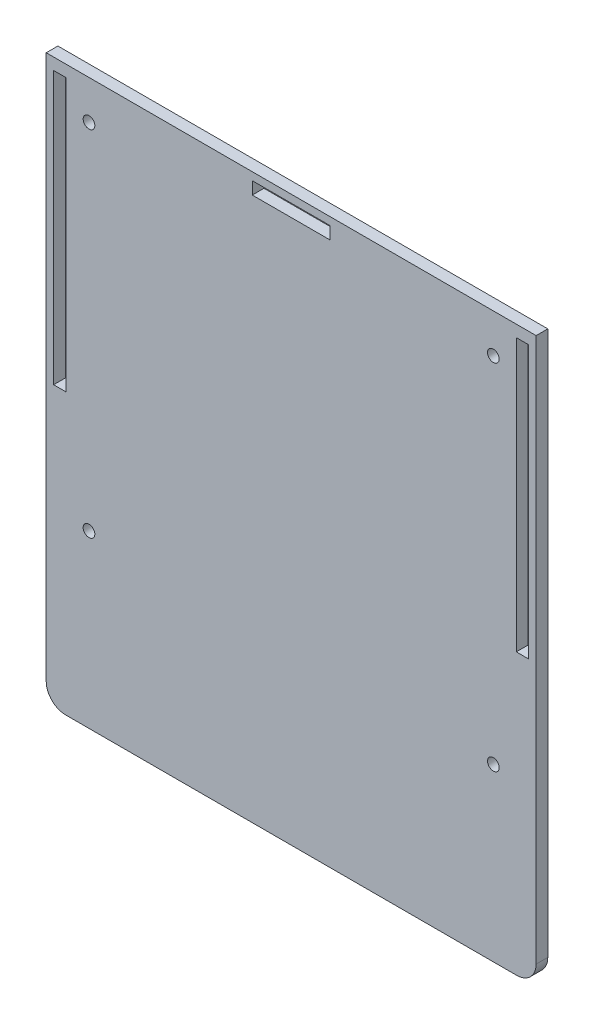
from build123d import *

# Parameters (mm, degrees)
SKETCH1_R           = 1.5
SKETCH1_W           = 20
SKETCH1_H           = 3.2
SKETCH1_W_2         = 3.2
SKETCH1_H_2         = 70
BOSS_EXTRUDE1_DEPTH = 3


with BuildPart() as part:
    # Sketch1 → Boss-Extrude1 (new body)
    with BuildSketch(Plane.XY):
        with BuildLine():
            Line((-58, -75), (58, -75))
            ThreePointArc((58, -75), (61.535533906, -73.535533906), (63, -70))
            Line((63, -70), (63, 70))
            Line((63, 70), (-63, 70))
            Line((-63, 70), (-63, -70))
            ThreePointArc((-63, -70), (-61.535533906, -73.535533906), (-58, -75))
        make_face()
        with Locations((-52, -31)):
            Circle(SKETCH1_R, mode=Mode.SUBTRACT)
        with Locations((52, -31)):
            Circle(SKETCH1_R, mode=Mode.SUBTRACT)
        with Locations((52, 60)):
            Circle(SKETCH1_R, mode=Mode.SUBTRACT)
        with Locations((-52, 60)):
            Circle(SKETCH1_R, mode=Mode.SUBTRACT)
        with Locations((0, 66.4)):
            Rectangle(SKETCH1_W, SKETCH1_H, mode=Mode.SUBTRACT)
        with Locations((-59.5, 32)):
            Rectangle(SKETCH1_W_2, SKETCH1_H_2, mode=Mode.SUBTRACT)
        with Locations((59.5, 32)):
            Rectangle(SKETCH1_W_2, SKETCH1_H_2, mode=Mode.SUBTRACT)
    extrude(amount=BOSS_EXTRUDE1_DEPTH)


solid = part.part
